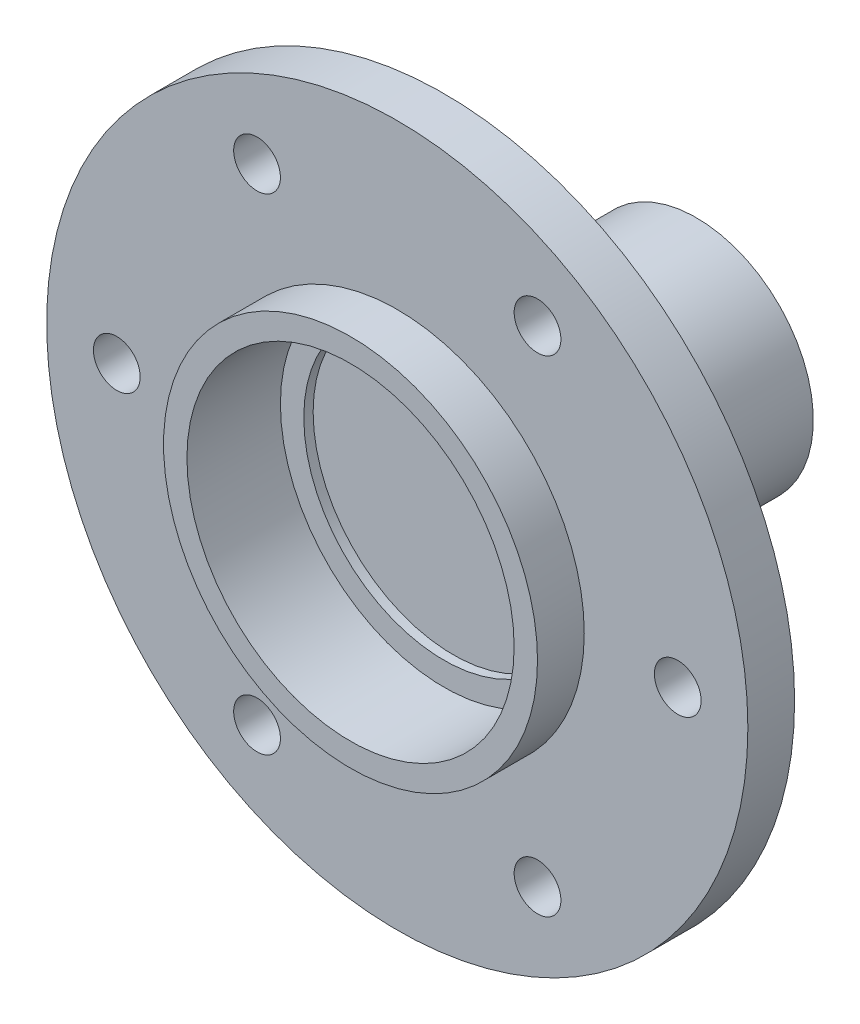
from build123d import *

# Parameters (mm, degrees)
SKETCH1_R           = 75
BOSS_EXTRUDE1_DEPTH = 10
SKETCH2_R           = 45
BOSS_EXTRUDE2_DEPTH = 10
SKETCH3_R           = 25
BOSS_EXTRUDE3_DEPTH = 44
FILLET1_R           = 20
SKETCH4_R           = 40
BOSS_EXTRUDE4_DEPTH = 10
SKETCH5_R           = 35
CUT_EXTRUDE1_DEPTH  = 20
SKETCH6_R           = 30
CUT_EXTRUDE2_DEPTH  = 2
SKETCH7_R           = 5
CUT_EXTRUDE3_DEPTH  = 124.878973196


with BuildPart() as part:
    # Sketch1 → Boss-Extrude1 (new body)
    with BuildSketch(Plane.XY):
        Circle(SKETCH1_R)
    extrude(amount=BOSS_EXTRUDE1_DEPTH)

    # Sketch2 → Boss-Extrude2 (add)
    with BuildSketch(Plane(origin=(0, 0, 0), x_dir=(-1, 0, 0), z_dir=(0, 0, -1))):
        Circle(SKETCH2_R)
    extrude(amount=BOSS_EXTRUDE2_DEPTH)

    # Sketch3 → Boss-Extrude3 (add)
    with BuildSketch(Plane(origin=(0, 0, -10), x_dir=(-1, 0, 0), z_dir=(0, 0, -1))):
        Circle(SKETCH3_R)
    extrude(amount=BOSS_EXTRUDE3_DEPTH)

    # Fillet1
    fillet1_edges = [part.edges().sort_by_distance(p)[0] for p in [
        (25, 0, -10),
    ]]
    fillet(fillet1_edges, radius=FILLET1_R - 0.0001)  # a hair under: the kernel refuses the full size

    # Sketch4 → Boss-Extrude4 (add)
    with BuildSketch(Plane.XY.offset(10)):
        Circle(SKETCH4_R)
    extrude(amount=BOSS_EXTRUDE4_DEPTH)

    # Sketch5 → Cut-Extrude1 (cut)
    with BuildSketch(Plane.XY.offset(20)):
        Circle(SKETCH5_R)
    extrude(amount=-CUT_EXTRUDE1_DEPTH, mode=Mode.SUBTRACT)

    # Sketch6 → Cut-Extrude2 (cut)
    with BuildSketch(Plane.XY):
        Circle(SKETCH6_R)
    extrude(amount=-CUT_EXTRUDE2_DEPTH, mode=Mode.SUBTRACT)

    # Sketch7 → Cut-Extrude3 (cut, through all)
    with BuildSketch(Plane.XY.offset(10)):
        with Locations((60, 0)):
            Circle(SKETCH7_R)
        with Locations((30, -51.961524227)):
            Circle(SKETCH7_R)
        with Locations((-30, -51.961524227)):
            Circle(SKETCH7_R)
        with Locations((-60, 0)):
            Circle(SKETCH7_R)
        with Locations((-30, 51.961524227)):
            Circle(SKETCH7_R)
        with Locations((30, 51.961524227)):
            Circle(SKETCH7_R)
    extrude(amount=-CUT_EXTRUDE3_DEPTH, mode=Mode.SUBTRACT)


solid = part.part
